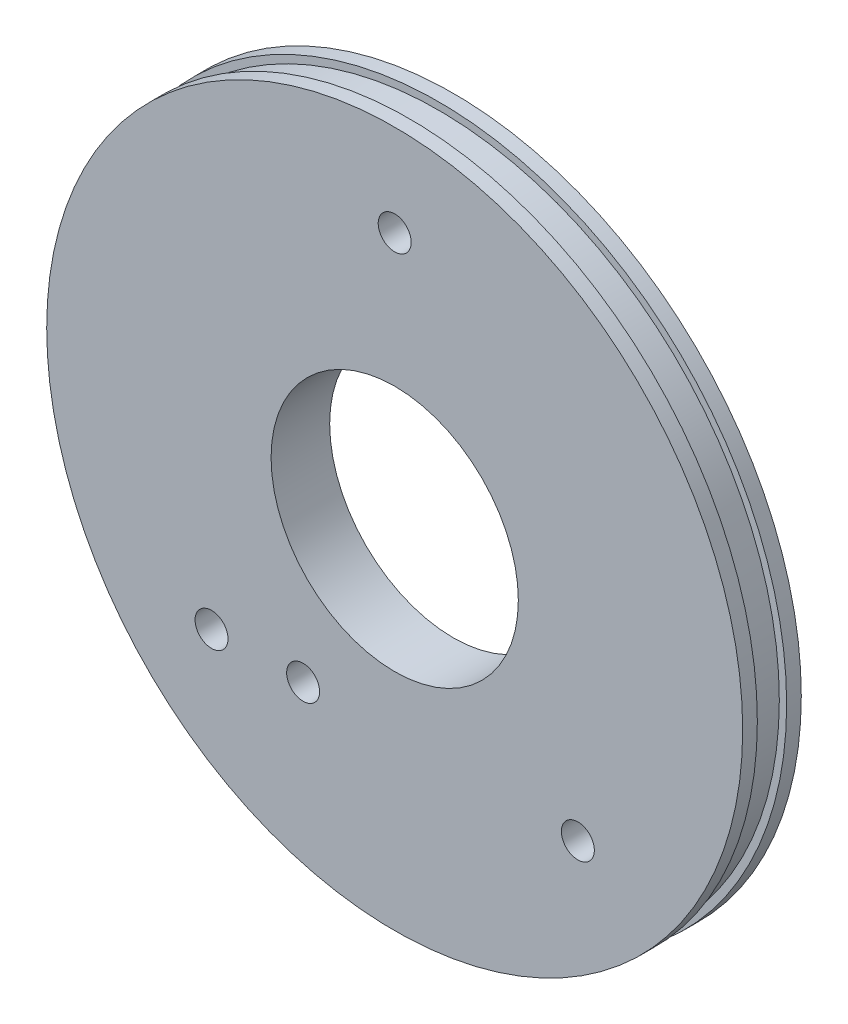
from build123d import *

# Parameters (mm, degrees)
BOSS_EXTRUDE1_DEPTH      = 8
BOSS_EXTRUDE1_DEPTH_BACK = 8
SKETCH2_R                = 95
CUT_EXTRUDE1_DEPTH       = 4
CUT_EXTRUDE1_DEPTH_BACK  = 4
SKETCH2_5_R              = 95
SKETCH2_5_R_2            = 93
SKETCH7_R                = 4.5
CUT_EXTRUDE2_DEPTH       = 167
SKETCH3_R                = 33.75
CUT_EXTRUDE3_DEPTH       = 43
CUT_EXTRUDE4_DEPTH       = 112
CUT_EXTRUDE4_DEPTH_BACK  = 60
SKETCH10_R               = 4.5


with BuildPart() as part:
    # Sketch2 → Boss-Extrude1 (new, two sides: drawn at the far end of the back side and taken through both)
    with BuildSketch(Plane.XY.offset(-BOSS_EXTRUDE1_DEPTH_BACK)):
        Circle(SKETCH2_R)
    extrude(amount=BOSS_EXTRUDE1_DEPTH + BOSS_EXTRUDE1_DEPTH_BACK)

    # Sketch2<5> → Cut-Extrude1 (cut, two sides: drawn at the far end of the back side and taken through both)
    with BuildSketch(Plane.XY.offset(-CUT_EXTRUDE1_DEPTH_BACK)):
        Circle(SKETCH2_5_R)
        Circle(SKETCH2_5_R_2, mode=Mode.SUBTRACT)
    extrude(amount=CUT_EXTRUDE1_DEPTH + CUT_EXTRUDE1_DEPTH_BACK, mode=Mode.SUBTRACT)

    # Sketch7 → Cut-Extrude2 (cut)
    with BuildSketch(Plane.XY.offset(8)):
        with Locations((-50, -48.75)):
            Circle(SKETCH7_R)
        with Locations((50, -48.75)):
            Circle(SKETCH7_R)
        with Locations((-25, -48.75)):
            Circle(SKETCH7_R)
    extrude(amount=-CUT_EXTRUDE2_DEPTH, mode=Mode.SUBTRACT)

    # Sketch3 → Cut-Extrude3 (cut)
    with BuildSketch(Plane.XY.offset(8)):
        Circle(SKETCH3_R)
    extrude(amount=-CUT_EXTRUDE3_DEPTH, mode=Mode.SUBTRACT)

    # Sketch10 → Cut-Extrude4 (cut, two sides: drawn at the far end of the back side and taken through both)
    with BuildSketch(Plane(origin=(0, 0, -8), x_dir=(-1, 0, 0), z_dir=(0, 0, -1)).offset(-CUT_EXTRUDE4_DEPTH_BACK)):
        with Locations((0, 70)):
            Circle(SKETCH10_R)
    extrude(amount=CUT_EXTRUDE4_DEPTH + CUT_EXTRUDE4_DEPTH_BACK, mode=Mode.SUBTRACT)


solid = part.part
